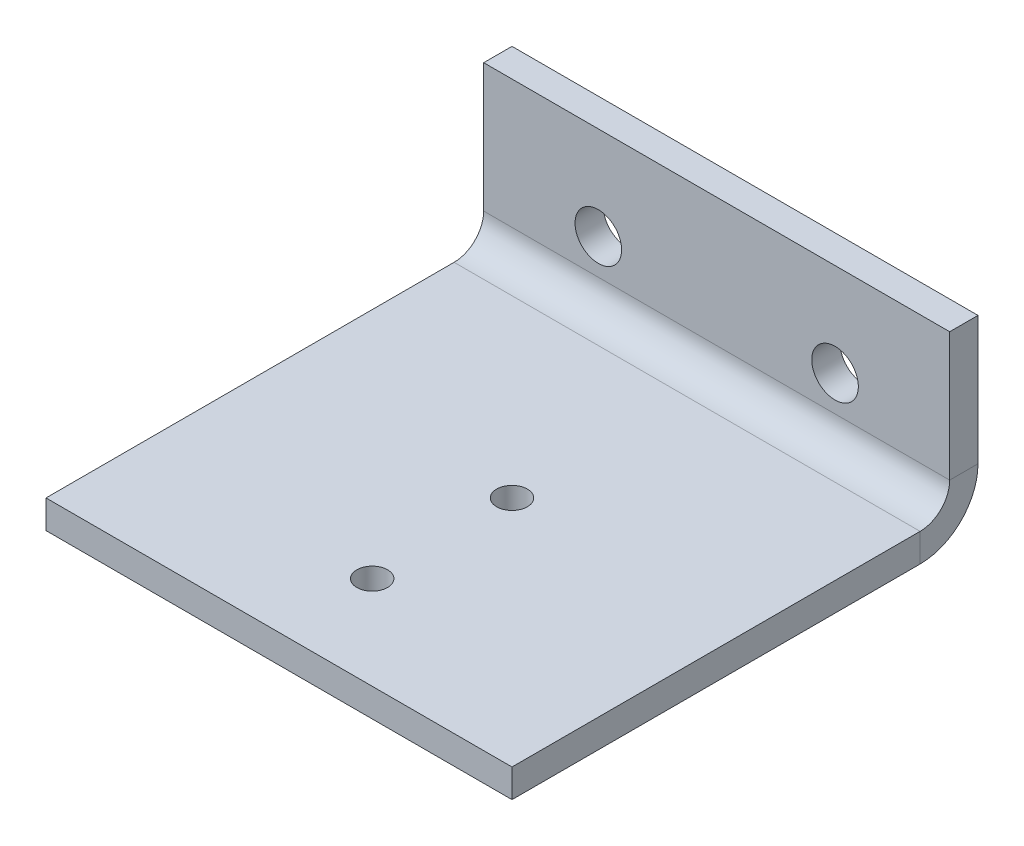
from build123d import *

# Parameters (mm, degrees)
CROQUIS1_W                       = 50
CROQUIS1_H                       = 20
CROQUIS1_R                       = 2.5
BRIDA_BASE1_DEPTH                = 3.03784
BRIDA_DE_ARISTA1_STRIP_W         = 18.50136
BRIDA_DE_ARISTA1_STRIP_H         = 3.03784
BRIDA_DE_ARISTA1_STRIP_CUT_DEPTH = 50
BRIDA_DE_ARISTA1_DEPTH           = 50
CORTAR_EXTRUIR1_REACH            = 58.837
CROQUIS9_R                       = 1.65


# Sheet-metal steps are written as plain solids
with BuildPart() as part:
    # Croquis1 → Brida base1 (new body)
    with BuildSketch(Plane.XY):
        Rectangle(CROQUIS1_W, CROQUIS1_H)
        with Locations((-12.7, 0)):
            Circle(CROQUIS1_R, mode=Mode.SUBTRACT)
        with Locations((12.7, 0)):
            Circle(CROQUIS1_R, mode=Mode.SUBTRACT)
    extrude(amount=-BRIDA_BASE1_DEPTH)

    # Brida de arista1 strip (across the edge) → Brida de arista1 strip cut (cut)
    with BuildSketch(Plane(origin=(-25, -10, 0), x_dir=(0, 1, 0), z_dir=(1, 0, 0))):
        with Locations((-3.03784, -1.51892)):
            Rectangle(BRIDA_DE_ARISTA1_STRIP_W, BRIDA_DE_ARISTA1_STRIP_H)
    extrude(amount=BRIDA_DE_ARISTA1_STRIP_CUT_DEPTH, mode=Mode.SUBTRACT)

    # Brida de arista1 section (across the edge) → Brida de arista1 (add)
    with BuildSketch(Plane(origin=(-25, -10, 0), x_dir=(0, 1, 0), z_dir=(1, 0, 0))):
        with BuildLine():
            Line((0, 3.175), (0, 46.96216))
            Line((0, 46.96216), (3.03784, 46.96216))
            Line((3.03784, 46.96216), (3.03784, 3.175))
            ThreePointArc((3.03784, 3.175), (3.96777597, 0.92993597), (6.21284, 0))
            Line((6.21284, 0), (6.21284, -3.03784))
            ThreePointArc((6.21284, -3.03784), (1.819698706, -1.218141294), (0, 3.175))
        make_face()
    extrude(amount=BRIDA_DE_ARISTA1_DEPTH)

    # Croquis9 → Cortar-Extruir1 (cut, up to next)
    with BuildSketch(Plane(origin=(0, -10, 0), x_dir=(-1, 0, 0), z_dir=(0, -1, 0)), mode=Mode.PRIVATE) as cortar_extruir1_sk1:
        with Locations(Location((0, -36.96216, 0), (0, 0, 90))):
            Circle(CROQUIS9_R)
    cortar_extruir1_tool1 = extrude(cortar_extruir1_sk1.sketch, amount=-CORTAR_EXTRUIR1_REACH, mode=Mode.PRIVATE) & part.part
    # Croquis9 → Cortar-Extruir1 (cut, up to next)
    with BuildSketch(Plane(origin=(0, -10, 0), x_dir=(-1, 0, 0), z_dir=(0, -1, 0)), mode=Mode.PRIVATE) as cortar_extruir1_sk2:
        with Locations(Location((0, -21.96216, 0), (0, 0, 90))):
            Circle(CROQUIS9_R)
    cortar_extruir1_tool2 = extrude(cortar_extruir1_sk2.sketch, amount=-CORTAR_EXTRUIR1_REACH, mode=Mode.PRIVATE) & part.part
    add(cortar_extruir1_tool1.solids().sort_by_distance((0, -10, 36.96216))[0], mode=Mode.SUBTRACT)
    add(cortar_extruir1_tool2.solids().sort_by_distance((0, -10, 21.96216))[0], mode=Mode.SUBTRACT)


solid = part.part
